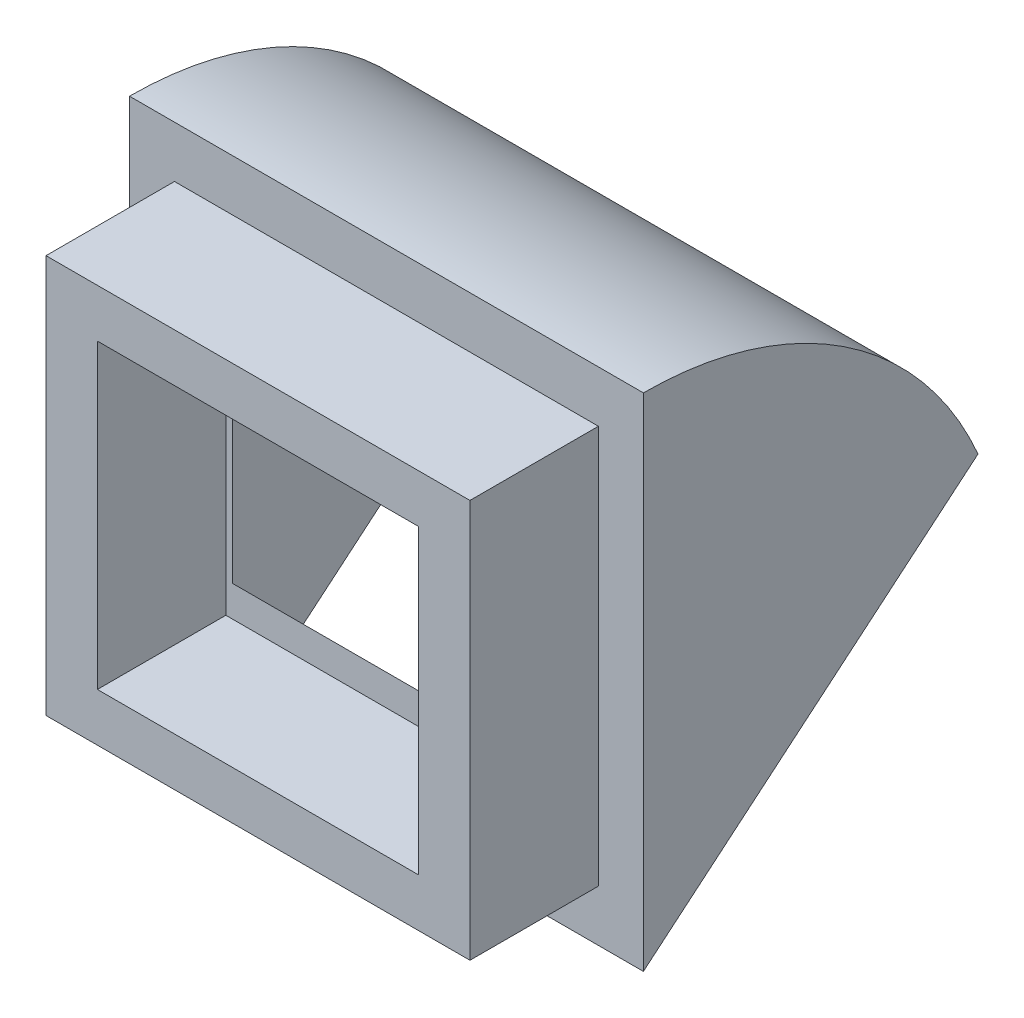
from build123d import *

# Parameters (mm, degrees)
SKETCH1_W           = 16.5
SKETCH1_H           = 15.5
SKETCH1_W_2         = 12.5
SKETCH1_H_2         = 11.742424242
BOSS_EXTRUDE1_DEPTH = 5
BOSS_EXTRUDE2_DEPTH = 10
CUT_SWEEP1_START    = -6
CUT_SWEEP1_DEPTH    = 12


# Read off the part's stored shape, not the designer's step: Cut-Sweep1
with BuildPart() as part:
    # Sketch1 → Boss-Extrude1 (new body)
    with BuildSketch(Plane.XY):
        Rectangle(SKETCH1_W, SKETCH1_H)
        Rectangle(SKETCH1_W_2, SKETCH1_H_2, mode=Mode.SUBTRACT)
    extrude(amount=BOSS_EXTRUDE1_DEPTH)

    # Sketch3 → Boss-Extrude2 (add, symmetric)
    with BuildSketch(Plane(origin=(0, 0, 0), x_dir=(0, 0, -1), z_dir=(1, 0, 0))):
        with BuildLine():
            Line((13.022755533, 1.177389365), (0, -9.75))
            Line((0, -9.75), (0, 9.75))
            ThreePointArc((0, 9.75), (7.794535943, 7.412955642), (13.022755533, 1.177389365))
        make_face()
    extrude(amount=BOSS_EXTRUDE2_DEPTH, both=True)

    # Cut-Sweep1 outline → Cut-Sweep1 (cut)
    with BuildSketch(Plane.YZ.offset(CUT_SWEEP1_START)):
        Polygon((-3.793172037, -7.099071125), (4.667171481, 0), (-4.667171481, 0), (-7.649897695, -2.502804467), align=None)
    extrude(amount=CUT_SWEEP1_DEPTH, mode=Mode.SUBTRACT)


solid = part.part
